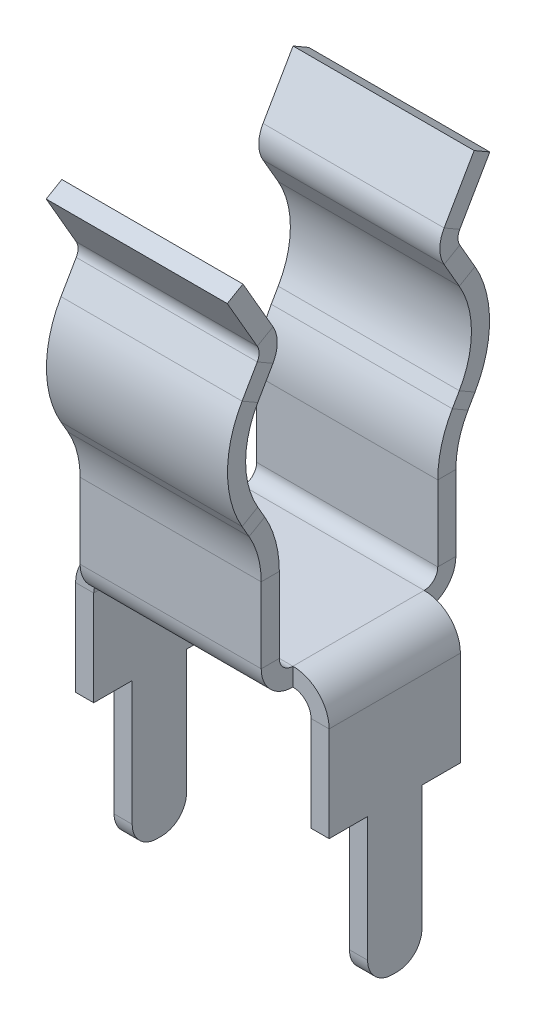
from build123d import *

# Parameters (mm, degrees)
SKETCH_1_W                         = 4
SKETCH_1_H                         = 3.5
SM_BASE_FLANGE_1_DEPTH             = 0.4
SM_EDGE_FLANGE_1_STRIP_W           = 2.2
SM_EDGE_FLANGE_1_STRIP_H           = 0.4
SM_EDGE_FLANGE_1_STRIP_CUT_DEPTH   = 4
SM_EDGE_FLANGE_1_STRIP_2_W         = 2.2
SM_EDGE_FLANGE_1_STRIP_2_H         = 0.4
SM_EDGE_FLANGE_1_STRIP_CUT_2_DEPTH = 4
SM_EDGE_FLANGE_1_DEPTH             = 4
SM_EDGE_FLANGE_1_BEND_DEPTH        = 4
SM_EDGE_FLANGE_2_STRIP_CUT_DEPTH   = 4
SM_EDGE_FLANGE_2_STRIP_CUT_2_DEPTH = 4
SM_EDGE_FLANGE_2_DEPTH             = 4
SM_EDGE_FLANGE_2_BEND_DEPTH        = 4
SM_START                           = -2
SM_EDGE_FLANGE_3_DEPTH             = 4
SM_EDGE_FLANGE_3_2_DEPTH           = 4
SM_EDGE_FLANGE_4_STRIP_CUT_DEPTH   = 4
SM_EDGE_FLANGE_4_STRIP_CUT_2_DEPTH = 4
SM_EDGE_FLANGE_4_DEPTH             = 4
SM_EDGE_FLANGE_4_BEND_DEPTH        = 4
SM_EDGE_FLANGE_5_DEPTH             = 2.9
SM_EDGE_FLANGE_5_BEND_DEPTH        = 2.9
CUT_EXTRUDE_1_DEPTH                = 10
CUT_EXTRUDE_1_DEPTH_BACK           = 10
SKETCH_36_W                        = 1.707463823
SKETCH_36_H                        = 4.810050527
SKETCH_36_W_2                      = 1.878862713
FILLET_1_R                         = 0.55


# Read off the part's stored shape, not the designer's step: Ребро-кромка3
# Sheet-metal steps are written as plain solids
with BuildPart() as part:
    # Sketch 1 → Базовая кромка1 (new body)
    with BuildSketch(Plane(origin=(0, 0, 0), x_dir=(1, 0, 0), z_dir=(0, 1, 0))):
        Rectangle(SKETCH_1_W, SKETCH_1_H)
    extrude(amount=-SM_BASE_FLANGE_1_DEPTH)

    # Ребро-кромка1 strip (across the edge) → Ребро-кромка1 strip cut (cut)
    with BuildSketch(Plane(origin=(-2, 0, 1.75), x_dir=(0, 0, -1), z_dir=(1, 0, 0))):
        with Locations((-0.8, -0.2)):
            Rectangle(SM_EDGE_FLANGE_1_STRIP_W, SM_EDGE_FLANGE_1_STRIP_H)
    extrude(amount=SM_EDGE_FLANGE_1_STRIP_CUT_DEPTH, mode=Mode.SUBTRACT)

    # Ребро-кромка1 strip 2 (across the edge) → Ребро-кромка1 strip cut 2 (cut)
    with BuildSketch(Plane(origin=(2, 0, -1.75), x_dir=(0, 0, 1), z_dir=(-1, 0, 0))):
        with Locations((-0.8, -0.2)):
            Rectangle(SM_EDGE_FLANGE_1_STRIP_2_W, SM_EDGE_FLANGE_1_STRIP_2_H)
    extrude(amount=SM_EDGE_FLANGE_1_STRIP_CUT_2_DEPTH, mode=Mode.SUBTRACT)

    # Ребро-кромка1 section (across the edge) → Ребро-кромка1 (add)
    with BuildSketch(Plane(origin=(-2, 0, 1.75), x_dir=(0, 0, -1), z_dir=(1, 0, 0))):
        with BuildLine():
            Line((-0.4, 0.3), (-0.4, 2.5))
            Line((-0.4, 2.5), (0, 2.5))
            Line((0, 2.5), (0, 0.3))
            ThreePointArc((0, 0.3), (0.087867966, 0.087867966), (0.3, 0))
            Line((0.3, 0), (0.3, -0.4))
            ThreePointArc((0.3, -0.4), (-0.194974747, -0.194974747), (-0.4, 0.3))
        make_face()
    extrude(amount=SM_EDGE_FLANGE_1_DEPTH)

    # Ребро-кромка1 section 2 (across the edge) → Ребро-кромка1 bend (add)
    with BuildSketch(Plane(origin=(2, 0, -1.75), x_dir=(0, 0, 1), z_dir=(-1, 0, 0))):
        with BuildLine():
            Line((-0.4, 0.3), (-0.4, 2.5))
            Line((-0.4, 2.5), (0, 2.5))
            Line((0, 2.5), (0, 0.3))
            ThreePointArc((0, 0.3), (0.087867966, 0.087867966), (0.3, 0))
            Line((0.3, 0), (0.3, -0.4))
            ThreePointArc((0.3, -0.4), (-0.194974747, -0.194974747), (-0.4, 0.3))
        make_face()
    extrude(amount=SM_EDGE_FLANGE_1_BEND_DEPTH)

    # Ребро-кромка2 strip (across the edge) → Ребро-кромка2 strip cut (cut)
    with BuildSketch(Plane(origin=(2, 2.5, 2.15), x_dir=(0, -0.49999999999999795, 0.8660254037844398), z_dir=(-1, 0, 0))):
        Polygon((-2.878460969, 4.185640646), (-0.078460969, -0.664101615), (0.267949192, -0.464101615), (-2.532050808, 4.385640646), align=None)
    extrude(amount=SM_EDGE_FLANGE_2_STRIP_CUT_DEPTH, mode=Mode.SUBTRACT)

    # Ребро-кромка2 strip 2 (across the edge) → Ребро-кромка2 strip cut 2 (cut)
    with BuildSketch(Plane(origin=(-2, 2.5, -2.15), x_dir=(0, -0.49999999999999495, -0.8660254037844416), z_dir=(1, 0, 0))):
        Polygon((-2.878460969, 4.185640646), (-0.078460969, -0.664101615), (0.267949192, -0.464101615), (-2.532050808, 4.385640646), align=None)
    extrude(amount=SM_EDGE_FLANGE_2_STRIP_CUT_2_DEPTH, mode=Mode.SUBTRACT)

    # Ребро-кромка2 section (across the edge) → Ребро-кромка2 (add)
    with BuildSketch(Plane(origin=(2, 2.5, 2.15), x_dir=(0, -0.49999999999999795, 0.8660254037844398), z_dir=(-1, 0, 0))):
        with BuildLine():
            Line((-0.4, 0.535898385), (-0.4, 2))
            Line((-0.4, 2), (0, 2))
            Line((0, 2), (0, 0.535898385))
            ThreePointArc((0, 0.535898385), (0.068148347, 0.018260295), (0.267949192, -0.464101615))
            Line((0.267949192, -0.464101615), (-0.078460969, -0.664101615))
            ThreePointArc((-0.078460969, -0.664101615), (-0.318221983, -0.085267323), (-0.4, 0.535898385))
        make_face()
    extrude(amount=SM_EDGE_FLANGE_2_DEPTH)

    # Ребро-кромка2 section 2 (across the edge) → Ребро-кромка2 bend (add)
    with BuildSketch(Plane(origin=(-2, 2.5, -2.15), x_dir=(0, -0.49999999999999495, -0.8660254037844416), z_dir=(1, 0, 0))):
        with BuildLine():
            Line((-0.4, 0.535898385), (-0.4, 2))
            Line((-0.4, 2), (0, 2))
            Line((0, 2), (0, 0.535898385))
            ThreePointArc((0, 0.535898385), (0.068148347, 0.018260295), (0.267949192, -0.464101615))
            Line((0.267949192, -0.464101615), (-0.078460969, -0.664101615))
            ThreePointArc((-0.078460969, -0.664101615), (-0.318221983, -0.085267323), (-0.4, 0.535898385))
        make_face()
    extrude(amount=SM_EDGE_FLANGE_2_BEND_DEPTH)

    # Ребро-кромка3 outline → Ребро-кромка3 (cut)
    with BuildSketch(Plane.YZ.offset(SM_START)):
        with BuildLine():
            ThreePointArc((3.232050808, 2.572649731), (3.785814556, 2.80554739), (4.380068552, 2.893625747))
            Line((4.380068552, 2.893625747), (4.232050808, 3.15))
            Line((4.232050808, 3.15), (3.232050808, 2.572649731))
        make_face()
        with BuildLine():
            Line((4.232050808, -3.15), (4.380068552, -2.893625747))
            ThreePointArc((4.380068552, -2.893625747), (3.785814556, -2.80554739), (3.232050808, -2.572649731))
            Line((3.232050808, -2.572649731), (4.232050808, -3.15))
        make_face()
    extrude(amount=SM_EDGE_FLANGE_3_DEPTH, mode=Mode.SUBTRACT)

    # Sm Edge Flange 3 2 outline → Sm Edge Flange 3 2 (add)
    with BuildSketch(Plane.YZ.offset(SM_START)):
        with BuildLine():
            Line((6.364101615, 2.15), (5.632050808, 2.572649731))
            ThreePointArc((5.632050808, 2.572649731), (5.028073111, 2.819002177), (4.380068552, 2.893625747))
            Line((4.380068552, 2.893625747), (4.432050808, 2.803589838))
            Line((4.432050808, 2.803589838), (3.432050808, 2.226239569))
            ThreePointArc((3.432050808, 2.226239569), (4.432050808, 2.494188762), (5.432050808, 2.226239569))
            Line((5.432050808, 2.226239569), (6.164101615, 1.803589838))
            Line((6.164101615, 1.803589838), (6.364101615, 2.15))
        make_face()
        with BuildLine():
            ThreePointArc((4.380068552, -2.893625747), (5.028073111, -2.819002177), (5.632050808, -2.572649731))
            Line((5.632050808, -2.572649731), (6.364101615, -2.15))
            Line((6.364101615, -2.15), (6.164101615, -1.803589838))
            Line((6.164101615, -1.803589838), (5.432050808, -2.226239569))
            ThreePointArc((5.432050808, -2.226239569), (4.432050808, -2.494188762), (3.432050808, -2.226239569))
            Line((3.432050808, -2.226239569), (4.432050808, -2.803589838))
            Line((4.432050808, -2.803589838), (4.380068552, -2.893625747))
        make_face()
    extrude(amount=SM_EDGE_FLANGE_3_2_DEPTH)

    # Ребро-кромка4 strip (across the edge) → Ребро-кромка4 strip cut (cut)
    with BuildSketch(Plane(origin=(2, 6.364101615, 2.15), x_dir=(0, -0.4999999999999979, 0.8660254037844399), z_dir=(-1, 0, 0))):
        Polygon((-1.955255888, 0.666987298), (-0.05, -0.433012702), (0.15, -0.08660254), (-1.755255888, 1.01339746), align=None)
    extrude(amount=SM_EDGE_FLANGE_4_STRIP_CUT_DEPTH, mode=Mode.SUBTRACT)

    # Ребро-кромка4 strip 2 (across the edge) → Ребро-кромка4 strip cut 2 (cut)
    with BuildSketch(Plane(origin=(-2, 6.364101615, -2.15), x_dir=(0, -0.4999999999999948, -0.8660254037844417), z_dir=(1, 0, 0))):
        Polygon((-1.955255888, 0.666987298), (-0.05, -0.433012702), (0.15, -0.08660254), (-1.755255888, 1.01339746), align=None)
    extrude(amount=SM_EDGE_FLANGE_4_STRIP_CUT_2_DEPTH, mode=Mode.SUBTRACT)

    # Ребро-кромка4 section (across the edge) → Ребро-кромка4 (add)
    with BuildSketch(Plane(origin=(2, 6.364101615, 2.15), x_dir=(0, -0.4999999999999979, 0.8660254037844399), z_dir=(-1, 0, 0))):
        with BuildLine():
            Line((-0.4, 0.173205081), (-0.4, 1.5))
            Line((-0.4, 1.5), (0, 1.5))
            Line((0, 1.5), (0, 0.173205081))
            ThreePointArc((0, 0.173205081), (0.040192379, 0.023205081), (0.15, -0.08660254))
            Line((0.15, -0.08660254), (-0.05, -0.433012702))
            ThreePointArc((-0.05, -0.433012702), (-0.306217783, -0.176794919), (-0.4, 0.173205081))
        make_face()
    extrude(amount=SM_EDGE_FLANGE_4_DEPTH)

    # Ребро-кромка4 section 2 (across the edge) → Ребро-кромка4 bend (add)
    with BuildSketch(Plane(origin=(-2, 6.364101615, -2.15), x_dir=(0, -0.4999999999999948, -0.8660254037844417), z_dir=(1, 0, 0))):
        with BuildLine():
            Line((-0.4, 0.173205081), (-0.4, 1.5))
            Line((-0.4, 1.5), (0, 1.5))
            Line((0, 1.5), (0, 0.173205081))
            ThreePointArc((0, 0.173205081), (0.040192379, 0.023205081), (0.15, -0.08660254))
            Line((0.15, -0.08660254), (-0.05, -0.433012702))
            ThreePointArc((-0.05, -0.433012702), (-0.306217783, -0.176794919), (-0.4, 0.173205081))
        make_face()
    extrude(amount=SM_EDGE_FLANGE_4_BEND_DEPTH)

    # Ребро-кромка5 section (across the edge) → Ребро-кромка5 (add)
    with BuildSketch(Plane(origin=(2.4, -0.4, -1.45), x_dir=(-1, 0, 0), z_dir=(0, 0, 1))):
        with BuildLine():
            Line((-0.4, 0.4), (-0.4, 5.8))
            Line((-0.4, 5.8), (0, 5.8))
            Line((0, 5.8), (0, 0.4))
            ThreePointArc((0, 0.4), (0.117157288, 0.117157288), (0.4, 0))
            Line((0.4, 0), (0.4, -0.4))
            ThreePointArc((0.4, -0.4), (-0.165685425, -0.165685425), (-0.4, 0.4))
        make_face()
    extrude(amount=SM_EDGE_FLANGE_5_DEPTH)

    # Ребро-кромка5 section 2 (across the edge) → Ребро-кромка5 bend (add)
    with BuildSketch(Plane(origin=(-2.4, -0.4, 1.45), x_dir=(1, 0, 0), z_dir=(0, 0, -1))):
        with BuildLine():
            Line((-0.4, 0.4), (-0.4, 5.8))
            Line((-0.4, 5.8), (0, 5.8))
            Line((0, 5.8), (0, 0.4))
            ThreePointArc((0, 0.4), (0.117157288, 0.117157288), (0.4, 0))
            Line((0.4, 0), (0.4, -0.4))
            ThreePointArc((0.4, -0.4), (-0.165685425, -0.165685425), (-0.4, 0.4))
        make_face()
    extrude(amount=SM_EDGE_FLANGE_5_BEND_DEPTH)

    # Эскиз36 → Вырез-Вытянуть1 (cut, two sides: drawn at the far end of the back side and taken through both)
    with BuildSketch(Plane(origin=(0, 0, 0), x_dir=(0, 0, -1), z_dir=(1, 0, 0)).offset(-CUT_EXTRUDE_1_DEPTH_BACK)):
        with Locations((1.453731912, -5.305025264)):
            Rectangle(SKETCH_36_W, SKETCH_36_H)
        with Locations((-1.539431357, -5.305025264)):
            Rectangle(SKETCH_36_W_2, SKETCH_36_H)
    extrude(amount=CUT_EXTRUDE_1_DEPTH + CUT_EXTRUDE_1_DEPTH_BACK, mode=Mode.SUBTRACT)

    # Скругление1
    fillet_1_edges = [part.edges().sort_by_distance(p)[0] for p in [
        (-2.6, -6.2, -0.6),
        (2.6, -6.2, -0.6),
        (-2.6, -6.2, 0.6),
        (2.6, -6.2, 0.6),
    ]]
    fillet(fillet_1_edges, radius=FILLET_1_R)


solid = part.part
